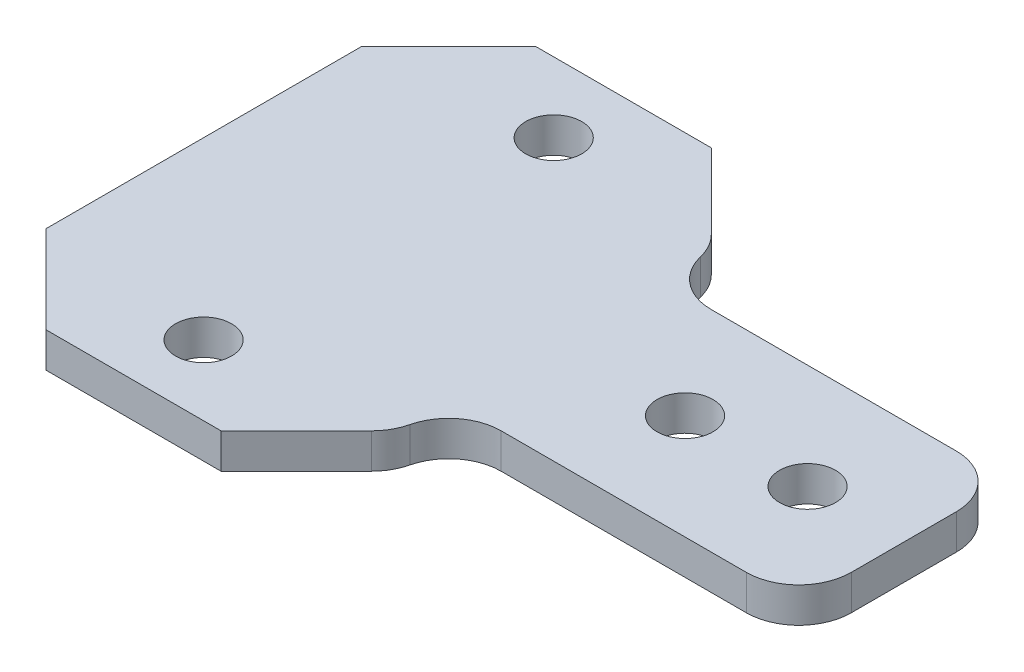
from build123d import *

# Parameters (mm, degrees)
SKETCH_1_R       = 1.6
EXTRUDE_1_DEPTH  = 2
CHAMFER_1_SIZE   = 5
FILLET_START     = -1
FILLET_1_DEPTH   = 4
FILLET_1_2_DEPTH = 2
FILLET_2_R       = 3


with BuildPart() as part:
    # 草图1 → 凸台-拉伸1 (new body)
    with BuildSketch(Plane(origin=(0, 0, 0), x_dir=(1, 0, 0), z_dir=(0, 1, 0))):
        Polygon((-10, -14), (-10, 14), (10, 14), (10, 6), (30, 6), (30, -6), (10, -6), (10, -14), align=None)
        with Locations(Location((0, 10, 0), (0, 0, 270))):
            Circle(SKETCH_1_R, mode=Mode.SUBTRACT)
        with Locations(Location((0, -10, 0), (0, 0, 90))):
            Circle(SKETCH_1_R, mode=Mode.SUBTRACT)
        with Locations(Location((17.5, 0, 0), (0, 0, 270))):
            Circle(SKETCH_1_R, mode=Mode.SUBTRACT)
        with Locations(Location((24.5, 0, 0), (0, 0, 270))):
            Circle(SKETCH_1_R, mode=Mode.SUBTRACT)
    extrude(amount=EXTRUDE_1_DEPTH)

    # 倒角1
    chamfer_1_edges = [part.edges().sort_by_distance(p)[0] for p in [
        (10, 1, 14),
        (-10, 1, 14),
        (-10, 1, -14),
        (10, 1, -14),
    ]]
    chamfer(chamfer_1_edges, length=CHAMFER_1_SIZE)

    # 圆角1: read off the stored shape, not the designer's step
    # 圆角1 outline → 圆角1 (cut)
    with BuildSketch(Plane(origin=(0, 0, 0), x_dir=(1, 0, 0), z_dir=(0, 1, 0)).offset(FILLET_START)):
        with BuildLine():
            ThreePointArc((27, 6), (29.121320344, 5.121320344), (30, 3))
            Line((30, 3), (30, 6))
            Line((30, 6), (27, 6))
        make_face()
        with BuildLine():
            ThreePointArc((30, -3), (29.121320344, -5.121320344), (27, -6))
            Line((27, -6), (30, -6))
            Line((30, -6), (30, -3))
        make_face()
    extrude(amount=FILLET_1_DEPTH, mode=Mode.SUBTRACT)

    # Fillet 1 2 outline → Fillet 1 2 (add)
    with BuildSketch(Plane(origin=(0, 0, 0), x_dir=(1, 0, 0), z_dir=(0, 1, 0))):
        with BuildLine():
            Line((10, 6), (13, 6))
            ThreePointArc((13, 6), (10.878679656, 6.878679656), (10, 9))
            Line((10, 9), (10, 6))
        make_face()
        with BuildLine():
            ThreePointArc((10, -9), (10.878679656, -6.878679656), (13, -6))
            Line((13, -6), (10, -6))
            Line((10, -6), (10, -9))
        make_face()
    extrude(amount=FILLET_1_2_DEPTH)

    # 圆角2
    fillet_2_edges = [part.edges().sort_by_distance(p)[0] for p in [
        (10, 1, 9),
        (10, 1, -9),
    ]]
    fillet(fillet_2_edges, radius=FILLET_2_R)


solid = part.part
